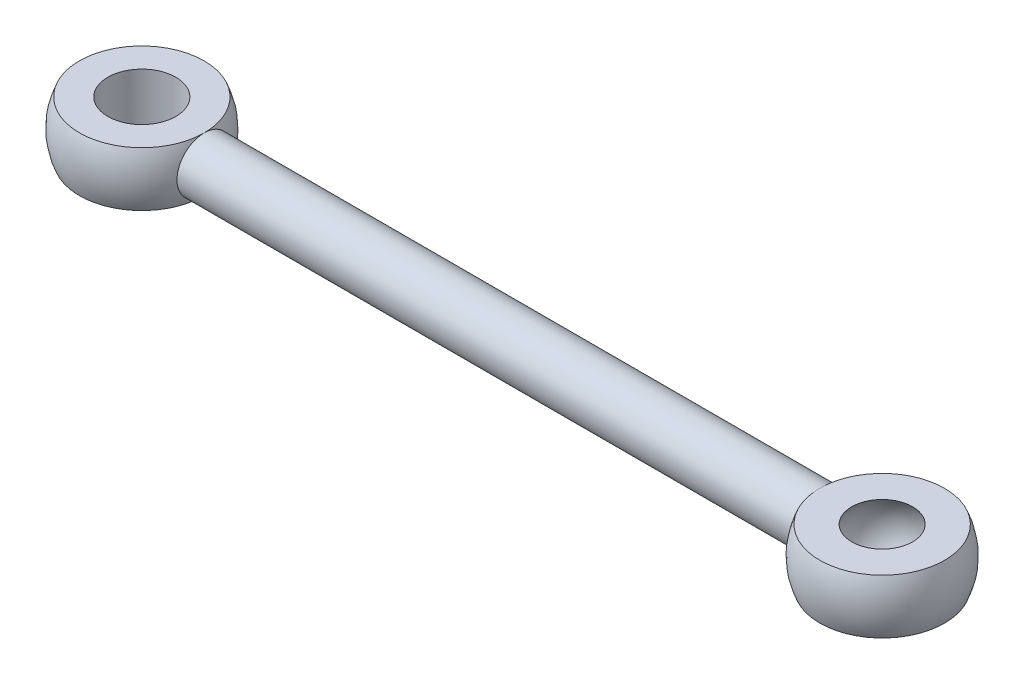
from build123d import *
from build123d.topology import SkipClean

# Parameters (mm, degrees)
CUT_EXTRUDE5_DEPTH      = 30
CUT_EXTRUDE5_DEPTH_BACK = 30
CUT_EXTRUDE6_DEPTH      = 30
CUT_EXTRUDE6_DEPTH_BACK = 30
SKETCH14_R              = 2.4999999999999982
CUT_EXTRUDE7_DEPTH      = 30


with BuildPart() as part:
    # Sketch1 → Revolve1 (revolve)
    with BuildSketch(Plane.XY):
        with BuildLine():
            Line((40.69842812129134, -4e-17), (-23.70157187870866, -1.168e-14))
            ThreePointArc((-23.70157187870866, -1.168e-14), (-19.723120097154766, 4.894531564653504), (-14.118996183752826, 1.9999999999999958))
            Line((-14.118996183752826, 1.9999999999999958), (31.1158524263355, 1.9999999999999958))
            ThreePointArc((31.1158524263355, 1.9999999999999958), (36.71997633973744, 4.8945315646535175), (40.69842812129134, -4e-17))
        make_face()
    revolve(axis=Axis((40.69842812129134, -4e-17, 0), (-1, -1.8e-16, 0)))

    # Sketch7 → Cut-Extrude5 (cut, two sides: drawn at the far end of the back side and taken through both)
    with SkipClean():  # the faces are left unmerged after this step: merging them gives an invalid solid
        with BuildSketch(Plane.XY.offset(-CUT_EXTRUDE5_DEPTH_BACK)):
            with BuildLine():
                Line((31.115852426335504, 1.9999999999999996), (40.28100381624718, 1.9999999999999996))
                ThreePointArc((40.28100381624718, 1.9999999999999996), (35.69842812129134, 4.999999999999996), (31.115852426335504, 1.9999999999999996))
            make_face()
            with BuildLine():
                Line((31.1158524263355, -1.9999999999999905), (40.281003816247186, -1.9999999999999905))
                ThreePointArc((40.281003816247186, -1.9999999999999905), (35.69842812129134, -4.999999999999998), (31.1158524263355, -1.9999999999999905))
            make_face()
        extrude(amount=CUT_EXTRUDE5_DEPTH + CUT_EXTRUDE5_DEPTH_BACK, mode=Mode.SUBTRACT)

    # Sketch9 → Cut-Revolve8 (revolve, cut)
    with SkipClean():  # the faces are left unmerged after this step: merging them gives an invalid solid
        with BuildSketch(Plane(origin=(0, 0, 0), x_dir=(1, 0, 0), z_dir=(0, 1, 0))):
            with BuildLine():
                Line((35.69842812129134, 3.0000000000000013), (35.69842812129134, -3.0000000000000013))
                ThreePointArc((35.69842812129134, -3.0000000000000013), (38.69842812129134, 0), (35.69842812129134, 3.0000000000000013))
            make_face()
        revolve(axis=Axis((35.69842812129134, 0, -3.0000000000000013), (0, 0, 1)), mode=Mode.SUBTRACT)

    # Sketch12 → Cut-Extrude6 (cut, two sides: drawn at the far end of the back side and taken through both)
    with SkipClean():  # the faces are left unmerged after this step: merging them gives an invalid solid
        with BuildSketch(Plane.XY.offset(-CUT_EXTRUDE6_DEPTH_BACK)):
            with BuildLine():
                Line((-14.118996183752826, 1.9999999999999918), (-23.284147573664495, 1.9999999999999918))
                ThreePointArc((-23.284147573664495, 1.9999999999999918), (-18.701571878708663, 4.999999999999988), (-14.118996183752826, 1.9999999999999918))
            make_face()
            with BuildLine():
                Line((-14.118996183752827, -2.000000000000018), (-23.284147573664495, -2.000000000000018))
                ThreePointArc((-23.284147573664495, -2.000000000000018), (-18.701571878708663, -5.000000000000007), (-14.118996183752827, -2.000000000000018))
            make_face()
        extrude(amount=CUT_EXTRUDE6_DEPTH + CUT_EXTRUDE6_DEPTH_BACK, mode=Mode.SUBTRACT)

    # Sketch14 → Cut-Extrude7 (cut)
    with SkipClean():  # the faces are left unmerged after this step: merging them gives an invalid solid
        with BuildSketch(Plane(origin=(0, 1.9999999999999918, 0), x_dir=(1, 0, 0), z_dir=(0, 1, 0))):
            with Locations((-18.701571878708663, 0)):
                Circle(SKETCH14_R)
        extrude(amount=-CUT_EXTRUDE7_DEPTH, mode=Mode.SUBTRACT)


solid = part.part
